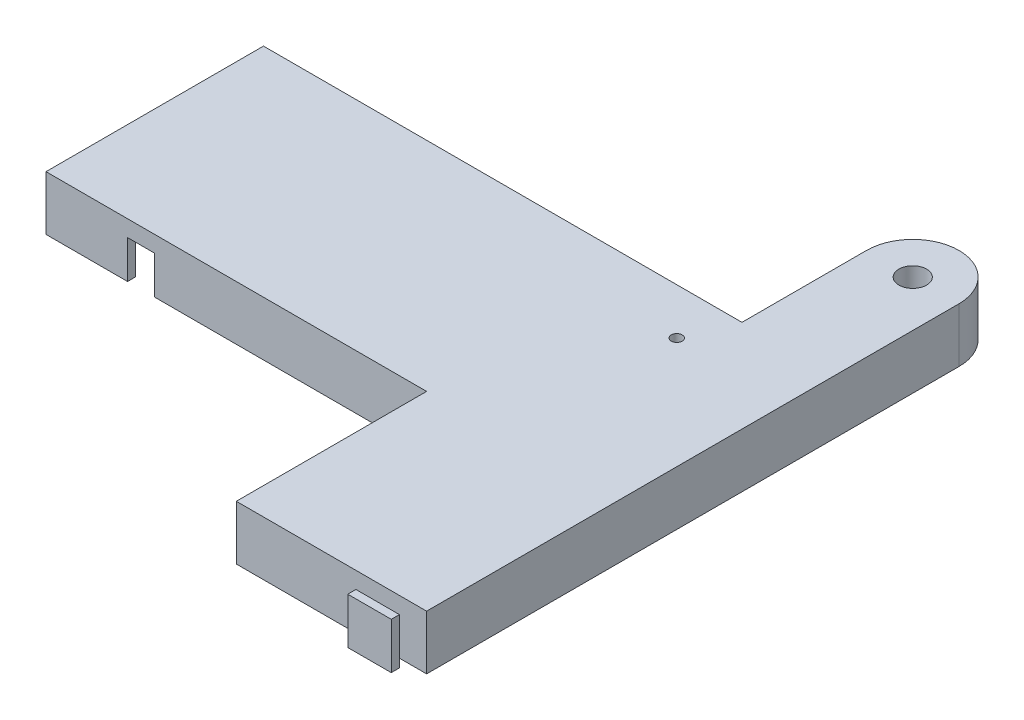
from build123d import *

# Parameters (mm, degrees)
CORNERBOSS_EXTRUDE1_DEPTH               = 20
SHELL1_T                                = -3
PADSKETCH2_R                            = 12
PADSKETCH2_R_2                          = 5
PADBOSS_EXTRUDE2_DEPTH                  = 10
STEPPERRODHOLESKETCH3_R                 = 5.1
STEPPERRODHOLESKETCH3_R_2               = 2
STEPPERRODHOLECUT_EXTRUDE1_DEPTH        = 255.298998474
THREADEDNUTMOUNTHOLESSKETCH4_R          = 1
THREADEDNUTMOUNTHOLESCUT_EXTRUDE2_DEPTH = 10
TLPEGHOLESKETCH1_W                      = 10
TLPEGHOLESKETCH1_H                      = 14
TLPEGHOLECUT_EXTRUDE1_DEPTH             = 3
BOTTOMPEGSKETCH2_W                      = 9.8
BOTTOMPEGSKETCH2_H                      = 13.9
BOTTOMPEGBOSS_EXTRUDE1_DEPTH            = 3.1
BOTTOMPEGCAPSKETCH3_W                   = 16
BOTTOMPEGCAPSKETCH3_H                   = 17
BOTTOMPEGCAPBOSS_EXTRUDE2_DEPTH         = 3
BEDCENTERHOLECUTSKETCH1_W               = 10
BEDCENTERHOLECUTSKETCH1_H               = 14
BEDCENTERHOLECUT_EXTRUDE1_DEPTH         = 3


with BuildPart() as part:
    # CornerSketch1 → CornerBoss-Extrude1 (new body)
    with BuildSketch(Plane(origin=(0, 0, 0), x_dir=(1, 0, 0), z_dir=(0, 1, 0))):
        with BuildLine():
            Line((210, -70), (140, -70))
            Line((140, -70), (140, 0))
            Line((140, 0), (0, 0))
            Line((0, 0), (0, 80))
            Line((0, 80), (176, 80))
            Line((176, 80), (176, 125.825))
            ThreePointArc((176, 125.825), (193, 142.825), (210, 125.825))
            Line((210, 125.825), (210, -70))
        make_face()
    extrude(amount=CORNERBOSS_EXTRUDE1_DEPTH)

    # Shell1
    shell1_openings = [part.faces().sort_by_distance(p)[0] for p in [
        (126.932214483, 0, -30.416556174),
    ]]
    offset(amount=SHELL1_T, openings=shell1_openings, kind=Kind.INTERSECTION)

    # PadSketch2 → PadBoss-Extrude2 (add)
    with BuildSketch(Plane.XZ.offset(-17)):
        with Locations((193, -125.825)):
            Circle(PADSKETCH2_R)
        with Locations((169, -63)):
            Circle(PADSKETCH2_R_2)
    extrude(amount=PADBOSS_EXTRUDE2_DEPTH)

    # StepperRodHoleSketch3 → StepperRodHoleCut-Extrude1 (cut, through all)
    with BuildSketch(Plane.XZ.offset(-7)):
        with Locations((193, -125.825)):
            Circle(STEPPERRODHOLESKETCH3_R)
        with Locations((169, -63)):
            Circle(STEPPERRODHOLESKETCH3_R_2)
    extrude(amount=-STEPPERRODHOLECUT_EXTRUDE1_DEPTH, mode=Mode.SUBTRACT)

    # ThreadedNutMountHolesSketch4 → ThreadedNutMountHolesCut-Extrude2 (cut)
    with BuildSketch(Plane(origin=(0, 7, 0), x_dir=(-1, 0, 0), z_dir=(0, -1, 0))):
        with Locations((-193, 133.825)):
            Circle(THREADEDNUTMOUNTHOLESSKETCH4_R)
        with Locations((-185, 125.825)):
            Circle(THREADEDNUTMOUNTHOLESSKETCH4_R)
        with Locations((-201, 125.825)):
            Circle(THREADEDNUTMOUNTHOLESSKETCH4_R)
        with Locations((-193, 117.825)):
            Circle(THREADEDNUTMOUNTHOLESSKETCH4_R)
    extrude(amount=-THREADEDNUTMOUNTHOLESCUT_EXTRUDE2_DEPTH, mode=Mode.SUBTRACT)

    # TLPegHoleSketch1 → TLPegHoleCut-Extrude1 (cut)
    with BuildSketch(Plane.ZY):
        with Locations((-65, 7)):
            Rectangle(TLPEGHOLESKETCH1_W, TLPEGHOLESKETCH1_H)
    extrude(amount=-TLPEGHOLECUT_EXTRUDE1_DEPTH, mode=Mode.SUBTRACT)

    # BottomPegSketch2 → BottomPegBoss-Extrude1 (add)
    with BuildSketch(Plane.XY.offset(70)):
        with Locations((195, 6.95)):
            Rectangle(BOTTOMPEGSKETCH2_W, BOTTOMPEGSKETCH2_H)
    extrude(amount=BOTTOMPEGBOSS_EXTRUDE1_DEPTH)

    # BottomPegCapSketch3 → BottomPegCapBoss-Extrude2 (add)
    with BuildSketch(Plane.XY.offset(73.1)):
        with Locations((195.1, 8.5)):
            Rectangle(BOTTOMPEGCAPSKETCH3_W, BOTTOMPEGCAPSKETCH3_H)
    extrude(amount=BOTTOMPEGCAPBOSS_EXTRUDE2_DEPTH)

    # BedCenterHoleCutSketch1 → BedCenterHoleCut-Extrude1 (cut)
    with BuildSketch(Plane.XY):
        with Locations((35, 7)):
            Rectangle(BEDCENTERHOLECUTSKETCH1_W, BEDCENTERHOLECUTSKETCH1_H)
    extrude(amount=-BEDCENTERHOLECUT_EXTRUDE1_DEPTH, mode=Mode.SUBTRACT)


solid = part.part
